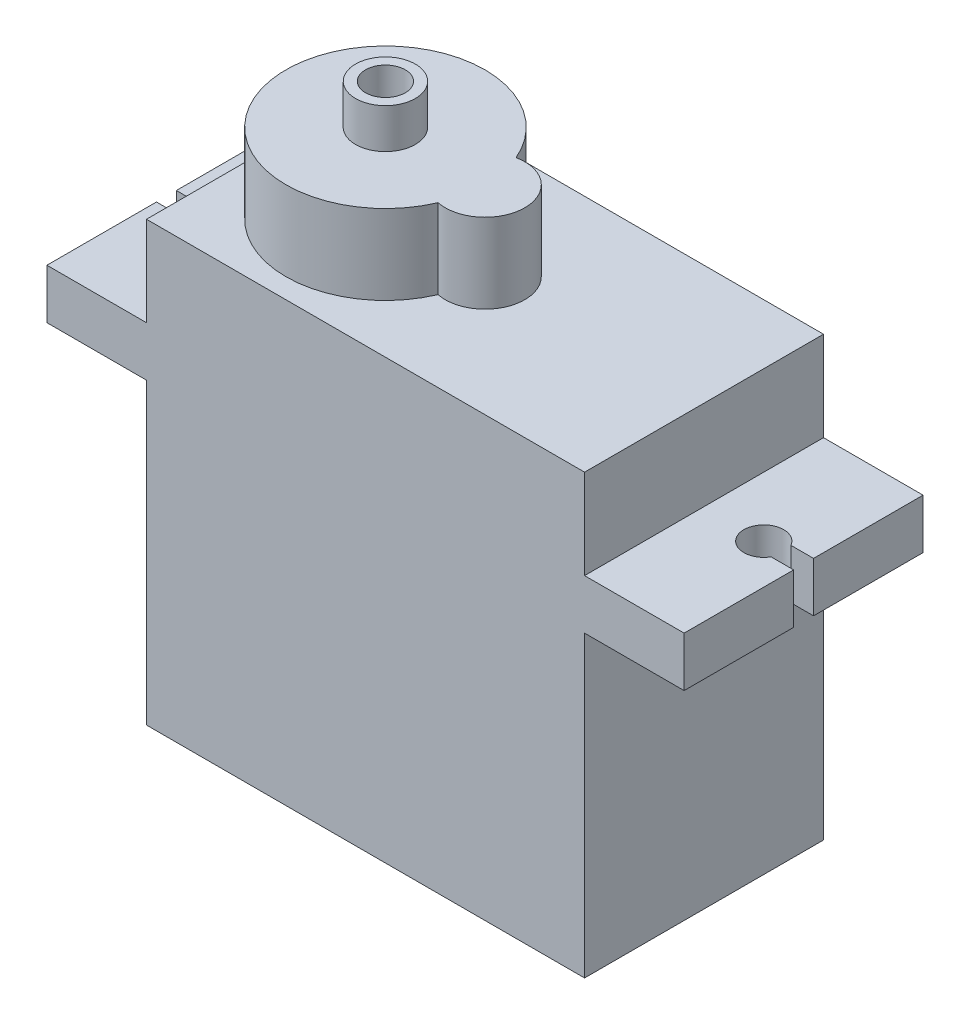
from build123d import *

# Parameters (mm, degrees)
SKETCH1_W             = 22
SKETCH1_H             = 12
BODY_DEPTH            = 22
HUB_DEPTH             = 4
SKETCH3_R             = 1.5
AXLE_DEPTH            = 2
SKETCH4_W             = 32
SKETCH4_H             = 12
FIN_DEPTH             = 2.5
SKETCH5_W             = 4
SKETCH5_H             = 1
WIRE_OUT_DEPTH        = 0.5
HOLE_FOR_SCREWS_REACH = 24.738
SKETCH6_R             = 1
SKETCH7_R             = 1
CUT_EXTRUDE1_DEPTH    = 6
CUT_EXTRUDE2_REACH    = 24.738
SKETCH8_W             = 2
SKETCH8_H             = 1


with BuildPart() as part:
    # Sketch1 → Body (new body)
    with BuildSketch(Plane(origin=(0, 0, 0), x_dir=(1, 0, 0), z_dir=(0, 1, 0))):
        Rectangle(SKETCH1_W, SKETCH1_H)
    extrude(amount=BODY_DEPTH)

    # Sketch2 → Hub (add)
    with BuildSketch(Plane(origin=(0, 22, 0), x_dir=(1, 0, 0), z_dir=(0, 1, 0))):
        with BuildLine():
            ThreePointArc((-0.4, 1.959591794), (-10, 0), (-0.4, -1.959591794))
            ThreePointArc((-0.4, -1.959591794), (2, 0), (-0.4, 1.959591794))
        make_face()
    extrude(amount=HUB_DEPTH)

    # Sketch3 → Axle (add)
    with BuildSketch(Plane(origin=(0, 26, 0), x_dir=(1, 0, 0), z_dir=(0, 1, 0))):
        with Locations((-5, 0)):
            Circle(SKETCH3_R)
    extrude(amount=AXLE_DEPTH)

    # Sketch4 → Fin (add)
    with BuildSketch(Plane(origin=(0, 15, 0), x_dir=(1, 0, 0), z_dir=(0, 1, 0))):
        Rectangle(SKETCH4_W, SKETCH4_H)
    extrude(amount=FIN_DEPTH)

    # Sketch5 → Wire out (add)
    with BuildSketch(Plane.ZY.offset(11)):
        with Locations((0, 4)):
            Rectangle(SKETCH5_W, SKETCH5_H)
    extrude(amount=WIRE_OUT_DEPTH)

    # Sketch6 → Hole for screws (cut, up to next)
    with BuildSketch(Plane(origin=(0, 15, 0), x_dir=(1, 0, 0), z_dir=(0, 1, 0)), mode=Mode.PRIVATE) as hole_for_screws_sk1:
        with Locations((-14, 0)):
            Circle(SKETCH6_R)
    hole_for_screws_tool1 = extrude(hole_for_screws_sk1.sketch, amount=HOLE_FOR_SCREWS_REACH, mode=Mode.PRIVATE) & part.part
    # Sketch6 → Hole for screws (cut, up to next)
    with BuildSketch(Plane(origin=(0, 15, 0), x_dir=(1, 0, 0), z_dir=(0, 1, 0)), mode=Mode.PRIVATE) as hole_for_screws_sk2:
        with Locations((14, 0)):
            Circle(SKETCH6_R)
    hole_for_screws_tool2 = extrude(hole_for_screws_sk2.sketch, amount=HOLE_FOR_SCREWS_REACH, mode=Mode.PRIVATE) & part.part
    add(hole_for_screws_tool1.solids().sort_by_distance((-14, 15, 0))[0], mode=Mode.SUBTRACT)
    add(hole_for_screws_tool2.solids().sort_by_distance((14, 15, 0))[0], mode=Mode.SUBTRACT)

    # Sketch7 → Cut-Extrude1 (cut)
    with BuildSketch(Plane(origin=(0, 28, 0), x_dir=(1, 0, 0), z_dir=(0, 1, 0))):
        with Locations((-5, 0)):
            Circle(SKETCH7_R)
    extrude(amount=-CUT_EXTRUDE1_DEPTH, mode=Mode.SUBTRACT)

    # Sketch8 → Cut-Extrude2 (cut, up to next)
    with BuildSketch(Plane(origin=(0, 15, 0), x_dir=(1, 0, 0), z_dir=(0, 1, 0)), mode=Mode.PRIVATE) as cut_extrude2_sk1:
        with Locations((-15.5, 0)):
            Rectangle(SKETCH8_W, SKETCH8_H)
    cut_extrude2_tool1 = extrude(cut_extrude2_sk1.sketch, amount=CUT_EXTRUDE2_REACH, mode=Mode.PRIVATE) & part.part
    # Sketch8 → Cut-Extrude2 (cut, up to next)
    with BuildSketch(Plane(origin=(0, 15, 0), x_dir=(1, 0, 0), z_dir=(0, 1, 0)), mode=Mode.PRIVATE) as cut_extrude2_sk2:
        with Locations((15.5, 0)):
            Rectangle(SKETCH8_W, SKETCH8_H)
    cut_extrude2_tool2 = extrude(cut_extrude2_sk2.sketch, amount=CUT_EXTRUDE2_REACH, mode=Mode.PRIVATE) & part.part
    add(cut_extrude2_tool1.solids().sort_by_distance((-15.5, 15, 0))[0], mode=Mode.SUBTRACT)
    add(cut_extrude2_tool2.solids().sort_by_distance((15.5, 15, 0))[0], mode=Mode.SUBTRACT)


solid = part.part
